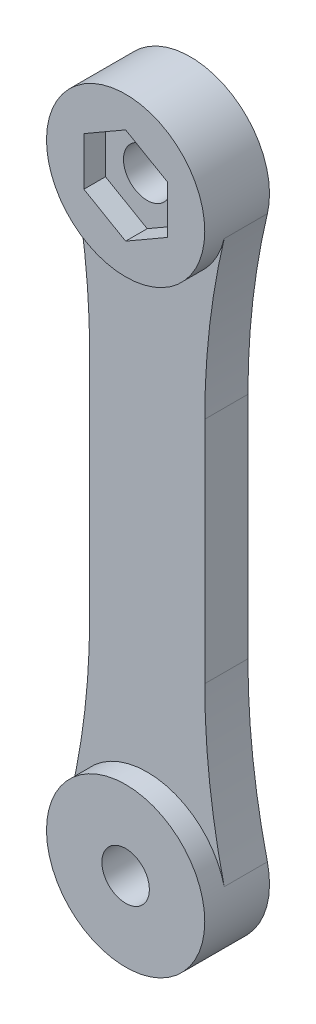
from build123d import *

# Parameters (mm, degrees)
SKETCH_1_R          = 1.65
EXTRUDE_1_DEPTH     = 3
SKETCH_2_R          = 5.5
SKETCH_2_R_2        = 1.65
EXTRUDE_2_DEPTH     = 1.5
FILLET_2_R          = 50
CUT_EXTRUDE_1_DEPTH = 1.5


with BuildPart() as part:
    # 草图1 → 凸台-拉伸1 (new body)
    with BuildSketch(Plane.XY):
        with BuildLine():
            Line((-2.170396733, 17.309509621), (-2.170396733, -16.690490379))
            ThreePointArc((-2.170396733, -16.690490379), (1.829603267, -25.965407597), (5.829603267, -16.690490379))
            Line((5.829603267, -16.690490379), (5.829603267, 17.309509621))
            ThreePointArc((5.829603267, 17.309509621), (1.829603267, 26.584426838), (-2.170396733, 17.309509621))
        make_face()
        with Locations((1.829603267, 21.084426838)):
            Circle(SKETCH_1_R, mode=Mode.SUBTRACT)
        with Locations((1.829603267, -20.465407597)):
            Circle(SKETCH_1_R, mode=Mode.SUBTRACT)
    extrude(amount=EXTRUDE_1_DEPTH)

    # 草图2 → 凸台-拉伸2 (add)
    # profile 1 of 2: a face of its own
    with BuildSketch(Plane.XY.offset(3)):
        with Locations(Location((1.829603267, 21.084426838, 0), (0, 0, 223.341758227))):
            Circle(SKETCH_2_R)
        Polygon((-1.070396733, 22.758742619), (-1.070396733, 19.410111058), (1.829603267, 17.735795277), (4.729603267, 19.410111058), (4.729603267, 22.758742619), (1.829603267, 24.433058399), align=None, mode=Mode.SUBTRACT)
    # profile 2 of 2: a face of its own
    with BuildSketch(Plane.XY.offset(3)):
        with Locations(Location((1.829603267, -20.465407597, 0), (0, 0, 136.658241773))):
            Circle(SKETCH_2_R)
        with Locations((1.829603267, -20.465407597)):
            Circle(SKETCH_2_R_2, mode=Mode.SUBTRACT)
    extrude(amount=EXTRUDE_2_DEPTH)

    # 圆角2
    # the kernel refuses this fillet: 50 mm, written as the material it adds along each edge
    with BuildSketch(Plane(origin=(-2.170396733, -16.690490379, 0), x_dir=(0, 1, 0), z_dir=(0, 0, 1)), Plane(origin=(5.829603267, 17.309509621, 0), x_dir=(0, -1, 0), z_dir=(0, 0, 1))) as fillet_2_piece_1:
        with BuildLine():
            CenterArc((9.0410884, 50), FILLET_2_R, 256.648815668, 13.351184332)
            ThreePointArc((-2.504862607, 1.351351351), (-1.163505185, 0.840508981), (0, 0))
            Line((0, 0), (9.0410884, 0))
        make_face()
    extrude(amount=3)
    with BuildSketch(Plane(origin=(-2.170396733, 17.309509621, 0), x_dir=(0, -1, 0), z_dir=(0, 0, 1)), Plane(origin=(5.829603267, -16.690490379, 0), x_dir=(0, 1, 0), z_dir=(0, 0, 1))) as fillet_2_piece_2:
        with BuildLine():
            CenterArc((9.0410884, -50), FILLET_2_R, 90, 13.351184332)
            ThreePointArc((-2.504862607, -1.351351351), (-1.163505185, -0.840508981), (0, 0))
            Line((0, 0), (9.0410884, 0))
        make_face()
    extrude(amount=3)

    # 草图5 → 切除-拉伸1 (cut)
    with BuildSketch(Plane(origin=(0, 0, 0), x_dir=(-1, 0, 0), z_dir=(0, 0, -1))):
        Polygon((-4.729603267, -18.791091816), (-4.729603267, -22.139723378), (-1.829603267, -23.814039158), (1.070396733, -22.139723378), (1.070396733, -18.791091816), (-1.829603267, -17.116776036), align=None)
    extrude(amount=-CUT_EXTRUDE_1_DEPTH, mode=Mode.SUBTRACT)


solid = part.part
